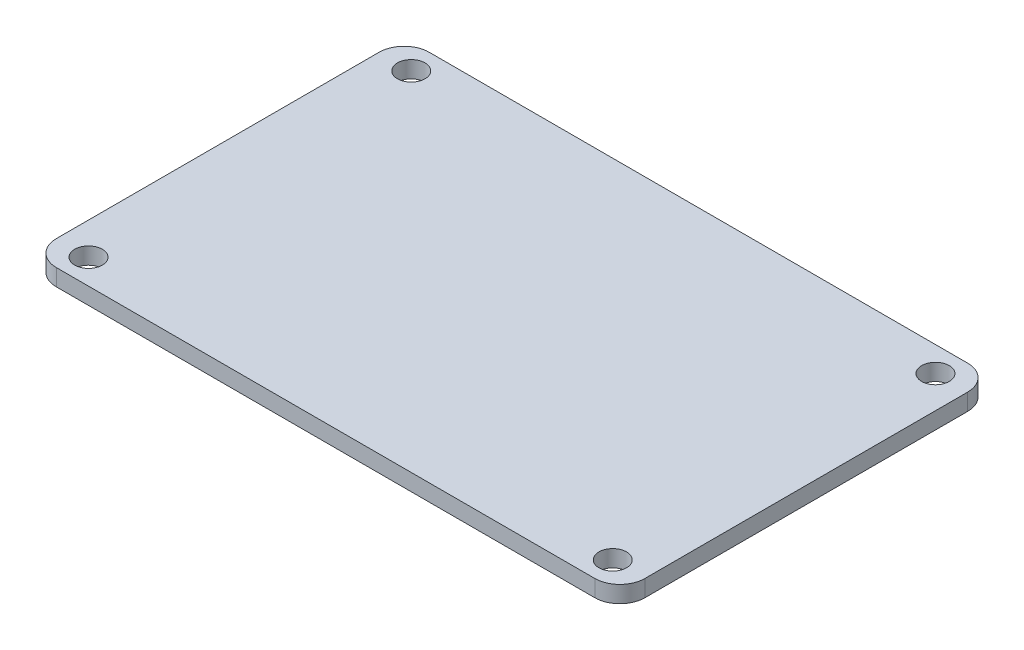
from build123d import *

# Parameters (mm, degrees)
SKETCH1_W           = 70.4
SKETCH1_H           = 44.6
BOSS_EXTRUDE1_DEPTH = 2
SKETCH3_R           = 1.65
CUT_EXTRUDE1_DEPTH  = 42.717262614
FILLET1_R           = 3


with BuildPart() as part:
    # Sketch1 → Boss-Extrude1 (new body)
    with BuildSketch(Plane(origin=(0, 0, 0), x_dir=(1, 0, 0), z_dir=(0, 1, 0))):
        Rectangle(SKETCH1_W, SKETCH1_H)
    extrude(amount=BOSS_EXTRUDE1_DEPTH)

    # Sketch3 → Cut-Extrude1 (cut, through all)
    with BuildSketch(Plane(origin=(0, 2, 0), x_dir=(1, 0, 0), z_dir=(0, 1, 0))):
        with Locations((-31.35, 19.3)):
            Circle(SKETCH3_R)
        with Locations((31.35, 19.3)):
            Circle(SKETCH3_R)
        with Locations((31.35, -19.3)):
            Circle(SKETCH3_R)
        with Locations((-31.35, -19.3)):
            Circle(SKETCH3_R)
    extrude(amount=-CUT_EXTRUDE1_DEPTH, mode=Mode.SUBTRACT)

    # Fillet1
    fillet1_edges = [part.edges().sort_by_distance(p)[0] for p in [
        (35.2, 1, -22.3),
        (35.2, 1, 22.3),
        (-35.2, 1, -22.3),
        (-35.2, 1, 22.3),
    ]]
    fillet(fillet1_edges, radius=FILLET1_R)


solid = part.part
